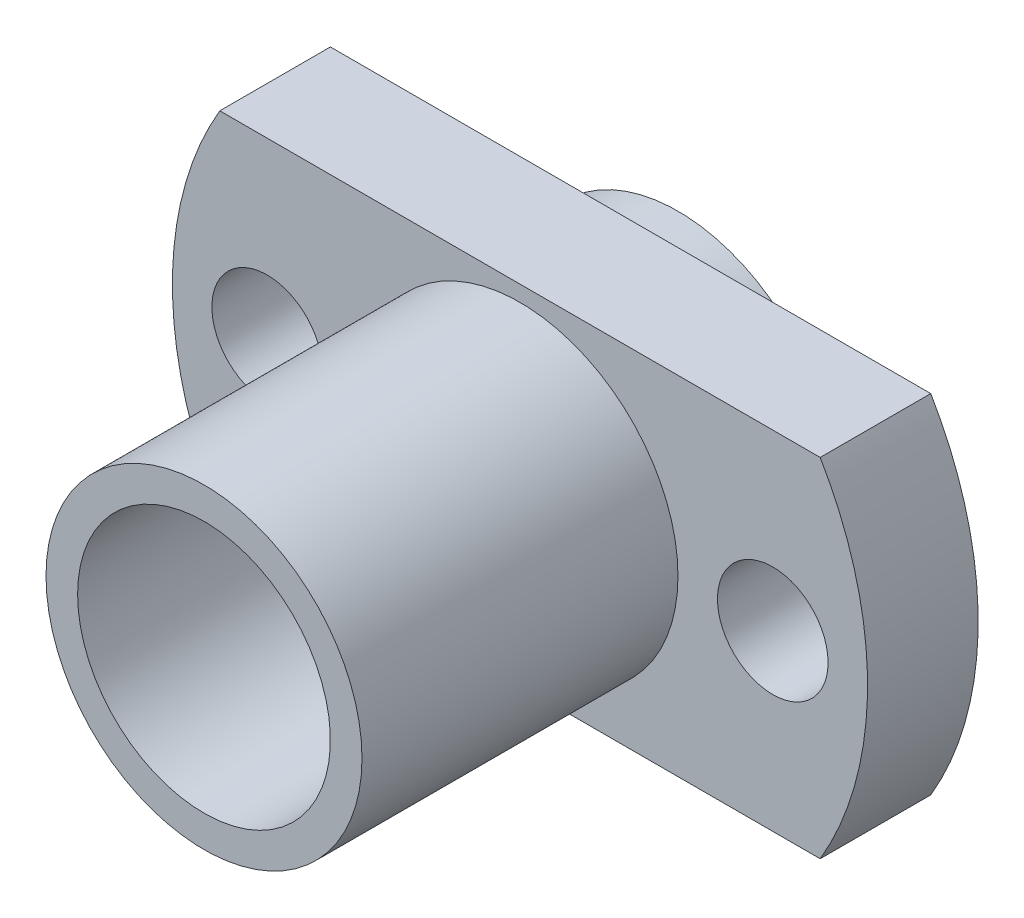
from build123d import *

# Parameters (mm, degrees)
SKETCH_1_R           = 1.75
EXTRUDE_1_DEPTH      = 3.5
EXTRUDE_2_DEPTH      = 1.5
EXTRUDE_2_DEPTH_BACK = 13.5
SKETCH_2_R           = 5
SKETCH_2_R_2         = 4
SKETCH_3_R           = 4
CUT_EXTRUDE_1_DEPTH  = 78.5


with BuildPart() as part:
    # 草图1 → 凸台-拉伸1 (new body)
    with BuildSketch(Plane.XY):
        with BuildLine():
            Line((-9.5, -5.5), (9.5, -5.5))
            ThreePointArc((9.5, -5.5), (11, 0), (9.5, 5.5))
            Line((9.5, 5.5), (-9.5, 5.5))
            ThreePointArc((-9.5, 5.5), (-11, 0), (-9.5, -5.5))
        make_face()
        with Locations((8, 0)):
            Circle(SKETCH_1_R, mode=Mode.SUBTRACT)
        with Locations((-8, 0)):
            Circle(SKETCH_1_R, mode=Mode.SUBTRACT)
    extrude(amount=EXTRUDE_1_DEPTH)

    # 草图2 → 凸台-拉伸2 (add, two sides: drawn at the far end of the back side and taken through both)
    with BuildSketch(Plane(origin=(0, 0, 0), x_dir=(-1, 0, 0), z_dir=(0, 0, -1)).offset(-EXTRUDE_2_DEPTH_BACK)):
        Circle(SKETCH_2_R)
        Circle(SKETCH_2_R_2, mode=Mode.SUBTRACT)
    extrude(amount=EXTRUDE_2_DEPTH + EXTRUDE_2_DEPTH_BACK)

    # 草图3 → 切除-拉伸1 (cut)
    with BuildSketch(Plane(origin=(0, 0, 0), x_dir=(-1, 0, 0), z_dir=(0, 0, -1))):
        Circle(SKETCH_3_R)
    extrude(amount=-CUT_EXTRUDE_1_DEPTH, mode=Mode.SUBTRACT)


solid = part.part
